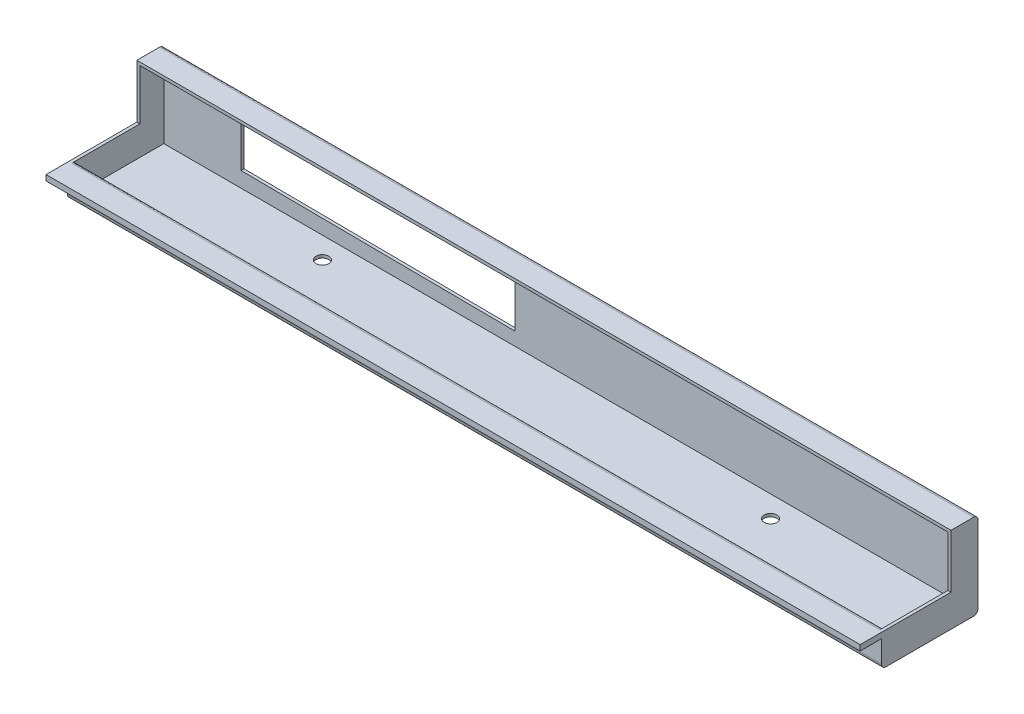
from build123d import *

# Parameters (mm, degrees)
SKETCH1_W           = 482.6
SKETCH1_H           = 50.8
BOSS_EXTRUDE1_DEPTH = 69.85
CUT_EXTRUDE2_DEPTH  = 49.022
SKETCH3_W           = 482.6
SKETCH3_H           = 16.002
CUT_EXTRUDE3_DEPTH  = 31.75
SKETCH4_W           = 482.6
SKETCH4_H           = 15.748
CUT_EXTRUDE4_DEPTH  = 12.7
SHELL2_START        = -23.622
SHELL2_OUTLINE_W    = 479.044
SHELL2_OUTLINE_H    = 14.224
SHELL2_DEPTH        = 47.244
SKETCH5_W           = 1.778
SKETCH5_H           = 17.272
BOSS_EXTRUDE2_DEPTH = 44.45
FILLET1_R           = 2.54
SKETCH6_R           = 3.81
CUT_EXTRUDE5_DEPTH  = 44.45
CUT_EXTRUDE6_REACH  = 254.487


# Read off the part's stored shape, not the designer's step: Shell2
with BuildPart() as part:
    # Sketch1 → Boss-Extrude1 (new body)
    with BuildSketch(Plane.XY):
        Rectangle(SKETCH1_W, SKETCH1_H)
    extrude(amount=BOSS_EXTRUDE1_DEPTH)

    # Sketch2 → Cut-Extrude2 (cut)
    with BuildSketch(Plane(origin=(0, 25.4, 0), x_dir=(1, 0, 0), z_dir=(0, 1, 0))):
        Polygon((241.3, -16.002), (-241.3, -16.002), (-241.3, -34.925), (-241.3, -53.848), (241.3, -53.848), align=None)
    extrude(amount=-CUT_EXTRUDE2_DEPTH, mode=Mode.SUBTRACT)

    # Sketch3 → Cut-Extrude3 (cut)
    with BuildSketch(Plane(origin=(0, 25.4, 0), x_dir=(1, 0, 0), z_dir=(0, 1, 0))):
        with Locations((0, -61.849)):
            Rectangle(SKETCH3_W, SKETCH3_H)
    extrude(amount=-CUT_EXTRUDE3_DEPTH, mode=Mode.SUBTRACT)

    # Sketch4 → Cut-Extrude4 (cut)
    with BuildSketch(Plane.XY.offset(69.85)):
        with Locations((0, -17.526)):
            Rectangle(SKETCH4_W, SKETCH4_H)
    extrude(amount=-CUT_EXTRUDE4_DEPTH, mode=Mode.SUBTRACT)

    # Shell2 outline → Shell2 (cut)
    with BuildSketch(Plane(origin=(0, 0, 0), x_dir=(1, 0, 0), z_dir=(0, 1, 0)).offset(SHELL2_START)):
        with Locations((0, -8.89)):
            Rectangle(SHELL2_OUTLINE_W, SHELL2_OUTLINE_H)
    extrude(amount=SHELL2_DEPTH, mode=Mode.SUBTRACT)

    # Sketch5 → Boss-Extrude2 (add)
    with BuildSketch(Plane(origin=(0, 0, 53.848), x_dir=(-1, 0, 0), z_dir=(0, 0, -1))):
        with Locations((240.411, -14.986)):
            Rectangle(SKETCH5_W, SKETCH5_H)
        with Locations((-240.411, -14.986)):
            Rectangle(SKETCH5_W, SKETCH5_H)
    extrude(amount=BOSS_EXTRUDE2_DEPTH)

    # Fillet1
    fillet1_edges = [part.edges().sort_by_distance(p)[0] for p in [
        (0, -25.4, 0),
        (0, -25.4, 57.15),
        (0, 25.4, 0),
        (0, -6.35, 53.848),
    ]]
    fillet(fillet1_edges, radius=FILLET1_R)

    # Sketch6 → Cut-Extrude5 (cut)
    with BuildSketch(Plane(origin=(0, -23.622, 0), x_dir=(1, 0, 0), z_dir=(0, 1, 0))):
        with Locations(Location((-132.842, -14.478, 0), (0, 0, 270))):
            Circle(SKETCH6_R)
        with Locations(Location((132.842, -14.478, 0), (0, 0, 270))):
            Circle(SKETCH6_R)
    extrude(amount=-CUT_EXTRUDE5_DEPTH, mode=Mode.SUBTRACT)

    # Sketch8 → Cut-Extrude6 (cut, up to next)
    with BuildSketch(Plane(origin=(0, 0, 0), x_dir=(-1, 0, 0), z_dir=(0, 0, -1)), mode=Mode.PRIVATE) as cut_extrude6_sk1:
        Polygon((31.482, 13.4), (31.482, -15.81), (193.836883288, -14.551149116), (193.836883288, 13.4), align=None)
    cut_extrude6_tool1 = extrude(cut_extrude6_sk1.sketch, amount=-CUT_EXTRUDE6_REACH, mode=Mode.PRIVATE) & part.part
    add(cut_extrude6_tool1.solids().sort_by_distance((-112.063522, -0.892598, 0))[0], mode=Mode.SUBTRACT)


solid = part.part
